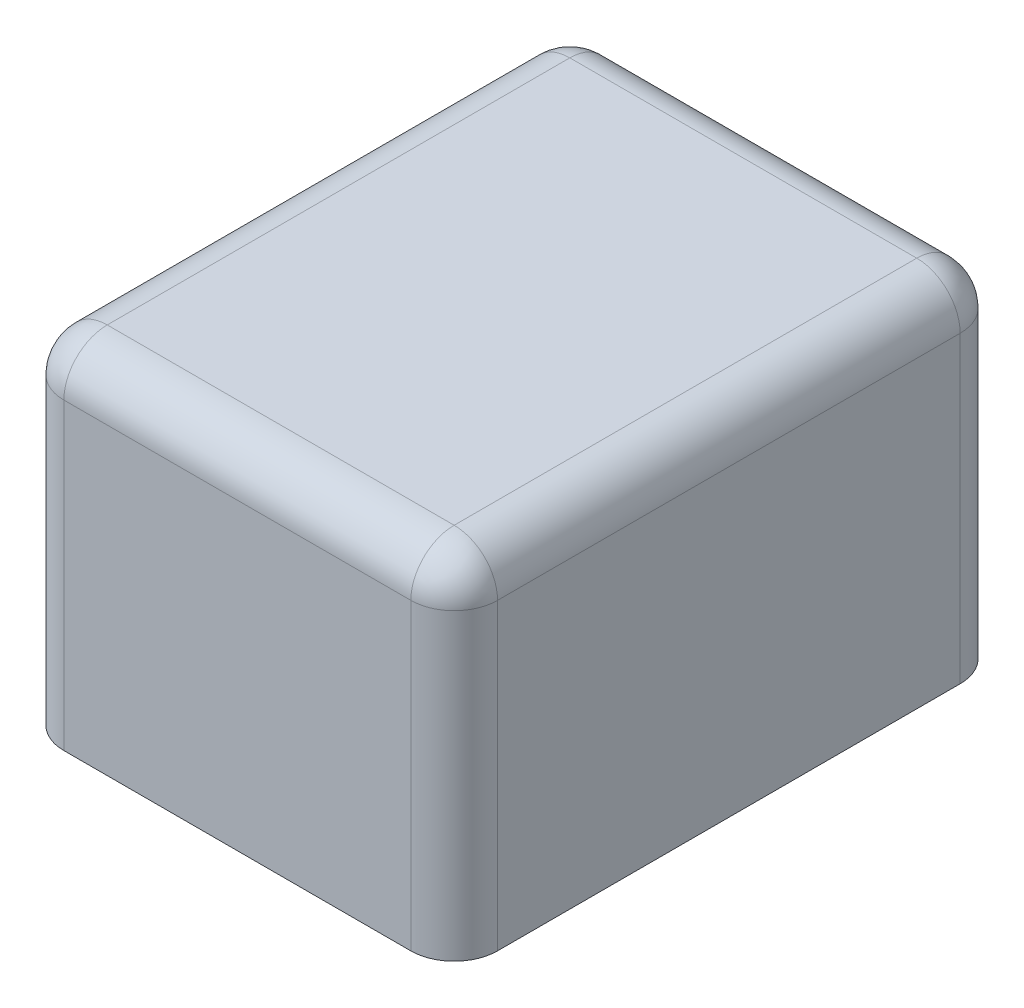
from build123d import *

# Parameters (mm, degrees)
SKETCH2_W           = 15
SKETCH2_H           = 19
BOSS_EXTRUDE1_DEPTH = 10
SKETCH3_W           = 15
SKETCH3_H           = 19
BOSS_EXTRUDE2_DEPTH = 2
FILLET1_R           = 1.5
FILLET3_R           = 1.5


with BuildPart() as part:
    # Sketch2 → Boss-Extrude1 (new body)
    with BuildSketch(Plane(origin=(0, 0, 0), x_dir=(1, 0, 0), z_dir=(0, 1, 0))):
        with Locations((7.5, 9.5)):
            Rectangle(SKETCH2_W, SKETCH2_H)
    extrude(amount=BOSS_EXTRUDE1_DEPTH)

    # Sketch3 → Boss-Extrude2 (add)
    with BuildSketch(Plane(origin=(0, 10, 0), x_dir=(1, 0, 0), z_dir=(0, 1, 0))):
        with Locations((7.5, 9.5)):
            Rectangle(SKETCH3_W, SKETCH3_H)
    extrude(amount=BOSS_EXTRUDE2_DEPTH)

    # Fillet1
    fillet1_edges = [part.edges().sort_by_distance(p)[0] for p in [
        (0, 12, -9.5),
        (7.5, 12, 0),
        (15, 12, -9.5),
        (7.5, 12, -19),
    ]]
    fillet(fillet1_edges, radius=FILLET1_R)

    # Fillet3
    # the kernel refuses this fillet: 1.5 mm, written as the material it takes off along each edge
    with BuildSketch(Plane(origin=(13.5, 10.5, -1.5), x_dir=(1, 0, 0), z_dir=(0, 0, 1))) as fillet3_piece_1_section:
        Polygon((0, 0), (FILLET3_R, 0), (FILLET3_R, FILLET3_R), (0, FILLET3_R), align=None)
    fillet3_piece_1 = extrude(amount=FILLET3_R, mode=Mode.PRIVATE)
    fillet3_piece_1 = fillet3_piece_1 - Plane(origin=(13.5, 10.5, -1.5), x_dir=(-0.7071067811865475, -0.7071067811865475, 0), z_dir=(0, 0, 1)) * Sphere(FILLET3_R, mode=Mode.PRIVATE)
    add(fillet3_piece_1, mode=Mode.SUBTRACT)
    with BuildSketch(Plane(origin=(1.5, 10.5, -1.5), x_dir=(-1, 0, 0), z_dir=(0, 0, 1))) as fillet3_piece_2_section:
        Polygon((0, 0), (FILLET3_R, 0), (FILLET3_R, -FILLET3_R), (0, -FILLET3_R), align=None)
    fillet3_piece_2 = extrude(amount=FILLET3_R, mode=Mode.PRIVATE)
    fillet3_piece_2 = fillet3_piece_2 - Plane(origin=(1.5, 10.5, -1.5), x_dir=(0.7071067811865475, -0.7071067811865475, 0), z_dir=(0, 0, 1)) * Sphere(FILLET3_R, mode=Mode.PRIVATE)
    add(fillet3_piece_2, mode=Mode.SUBTRACT)
    with BuildSketch(Plane(origin=(13.5, 10.5, -17.5), x_dir=(0, 0, -1), z_dir=(1, 0, 0))) as fillet3_piece_3_section:
        Polygon((0, 0), (FILLET3_R, 0), (FILLET3_R, FILLET3_R), (0, FILLET3_R), align=None)
    fillet3_piece_3 = extrude(amount=FILLET3_R, mode=Mode.PRIVATE)
    fillet3_piece_3 = fillet3_piece_3 - Plane(origin=(13.5, 10.5, -17.5), x_dir=(0, -0.7071067811865475, 0.7071067811865475), z_dir=(1, 0, 0)) * Sphere(FILLET3_R, mode=Mode.PRIVATE)
    add(fillet3_piece_3, mode=Mode.SUBTRACT)
    with BuildSketch(Plane(origin=(1.5, 10.5, -17.5), x_dir=(0, 0, -1), z_dir=(-1, 0, 0))) as fillet3_piece_4_section:
        Polygon((0, 0), (FILLET3_R, 0), (FILLET3_R, -FILLET3_R), (0, -FILLET3_R), align=None)
    fillet3_piece_4 = extrude(amount=FILLET3_R, mode=Mode.PRIVATE)
    fillet3_piece_4 = fillet3_piece_4 - Plane(origin=(1.5, 10.5, -17.5), x_dir=(0, -0.7071067811865475, 0.7071067811865475), z_dir=(-1, 0, 0)) * Sphere(FILLET3_R, mode=Mode.PRIVATE)
    add(fillet3_piece_4, mode=Mode.SUBTRACT)
    with BuildSketch(Plane(origin=(0, 10.5, -19), x_dir=(0, 0, 1), z_dir=(0, -1, 0)), Plane(origin=(15, -3.75, -19), x_dir=(0, 0, 1), z_dir=(0, 1, 0)), Plane(origin=(15, -3.75, 0), x_dir=(-1, 0, 0), z_dir=(0, 1, 0)), Plane(origin=(0, 10.5, 0), x_dir=(1, 0, 0), z_dir=(0, -1, 0))) as fillet3_piece_5:
        with BuildLine():
            CenterArc((FILLET3_R, -FILLET3_R), FILLET3_R, 90, 90)
            Line((0, -FILLET3_R), (0, 0))
            Line((0, 0), (FILLET3_R, 0))
        make_face()
    extrude(amount=14.25, mode=Mode.SUBTRACT)


solid = part.part
